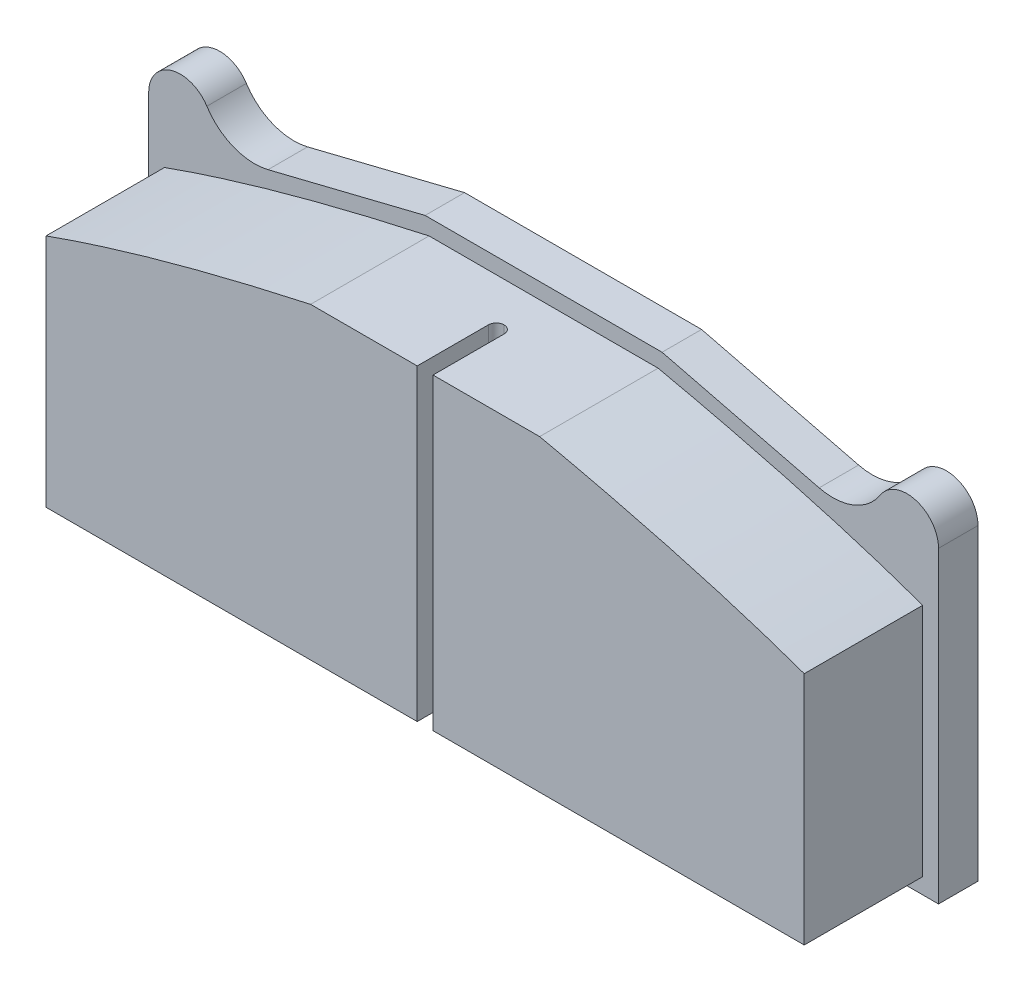
from build123d import *

# Parameters (mm, degrees)
BOSS_EXTRUDE5_DEPTH = 15
BOSS_EXTRUDE6_DEPTH = 5
SKETCH3_W           = 2
SKETCH3_H           = 39.156418696
CUT_EXTRUDE1_DEPTH  = 10
FILLET2_R           = 1


with BuildPart() as part:
    # Sketch2 → Boss-Extrude5 (new body)
    with BuildSketch(Plane.XY.offset(5)):
        with BuildLine():
            Line((-14.5, 19.421790652), (14.5, 19.421790652))
            add(Edge.make_bspline(
                [(14.5, 19.421790652), (34.327554894, 15.095349213), (48, 10.176108588)],
                knots=[0, 0, 0, 1, 1, 1], degree=2))
            Line((48, 10.176108588), (48, -19.578209348))
            Line((48, -19.578209348), (-48, -19.578209348))
            Line((-48, -19.578209348), (-48, 10.176108588))
            add(Edge.make_bspline(
                [(-14.5, 19.421790652), (-34.327554894, 15.095349213), (-48, 10.176108588)],
                knots=[0, 0, 0, 1, 1, 1], degree=2))
        make_face()
    extrude(amount=BOSS_EXTRUDE5_DEPTH)

    # Sketch1 → Boss-Extrude6 (add)
    # profile 1 of 2: a face of its own
    with BuildSketch(Plane.XY):
        with BuildLine():
            Line((-15, 21.421790652), (-34.887462632, 16.495927254))
            ThreePointArc((-34.887462632, 16.495927254), (-39.255473059, 16.793838072), (-42.632407856, 19.580337189))
            ThreePointArc((-42.632407856, 19.580337189), (-47.124640259, 21.2604342), (-50, 17.421790652))
            Line((-50, 17.421790652), (-50, -21.578209348))
            Line((-50, -21.578209348), (50, -21.578209348))
            Line((50, -21.578209348), (50, 17.421790652))
            ThreePointArc((50, 17.421790652), (47.124640259, 21.2604342), (42.632407856, 19.580337189))
            ThreePointArc((42.632407856, 19.580337189), (39.255473059, 16.793838072), (34.887462632, 16.495927254))
            Line((34.887462632, 16.495927254), (15, 21.421790652))
            Line((15, 21.421790652), (-15, 21.421790652))
        make_face()
        with BuildLine():
            add(Edge.make_bspline(
                [(-14.5, 19.421790652), (-34.327554894, 15.095349213), (-48, 10.176108588)],
                knots=[0, 0, 0, 1, 1, 1], degree=2))
            Line((-48, 10.176108588), (-48, -19.578209348))
            Line((-48, -19.578209348), (48, -19.578209348))
            Line((48, -19.578209348), (48, 10.176108588))
            add(Edge.make_bspline(
                [(14.5, 19.421790652), (34.327554894, 15.095349213), (48, 10.176108588)],
                knots=[0, 0, 0, 1, 1, 1], degree=2))
            Line((14.5, 19.421790652), (-14.5, 19.421790652))
        make_face(mode=Mode.SUBTRACT)
    # profile 2 of 2: a face of its own
    with BuildSketch(Plane.XY):
        with BuildLine():
            Line((-14.5, 19.421790652), (14.5, 19.421790652))
            add(Edge.make_bspline(
                [(14.5, 19.421790652), (34.327554894, 15.095349213), (48, 10.176108588)],
                knots=[0, 0, 0, 1, 1, 1], degree=2))
            Line((48, 10.176108588), (48, -19.578209348))
            Line((48, -19.578209348), (-48, -19.578209348))
            Line((-48, -19.578209348), (-48, 10.176108588))
            add(Edge.make_bspline(
                [(-14.5, 19.421790652), (-34.327554894, 15.095349213), (-48, 10.176108588)],
                knots=[0, 0, 0, 1, 1, 1], degree=2))
        make_face()
    extrude(amount=BOSS_EXTRUDE6_DEPTH)

    # Sketch3 → Cut-Extrude1 (cut)
    with BuildSketch(Plane.XY.offset(20)):
        Rectangle(SKETCH3_W, SKETCH3_H)
    extrude(amount=-CUT_EXTRUDE1_DEPTH, mode=Mode.SUBTRACT)

    # Fillet2
    fillet2_edges = [part.edges().sort_by_distance(p)[0] for p in [
        (1, -0.078209348, 10),
        (-1, -0.078209348, 10),
    ]]
    fillet(fillet2_edges, radius=FILLET2_R - 0.0001)  # a hair under: the kernel refuses the full size


solid = part.part
